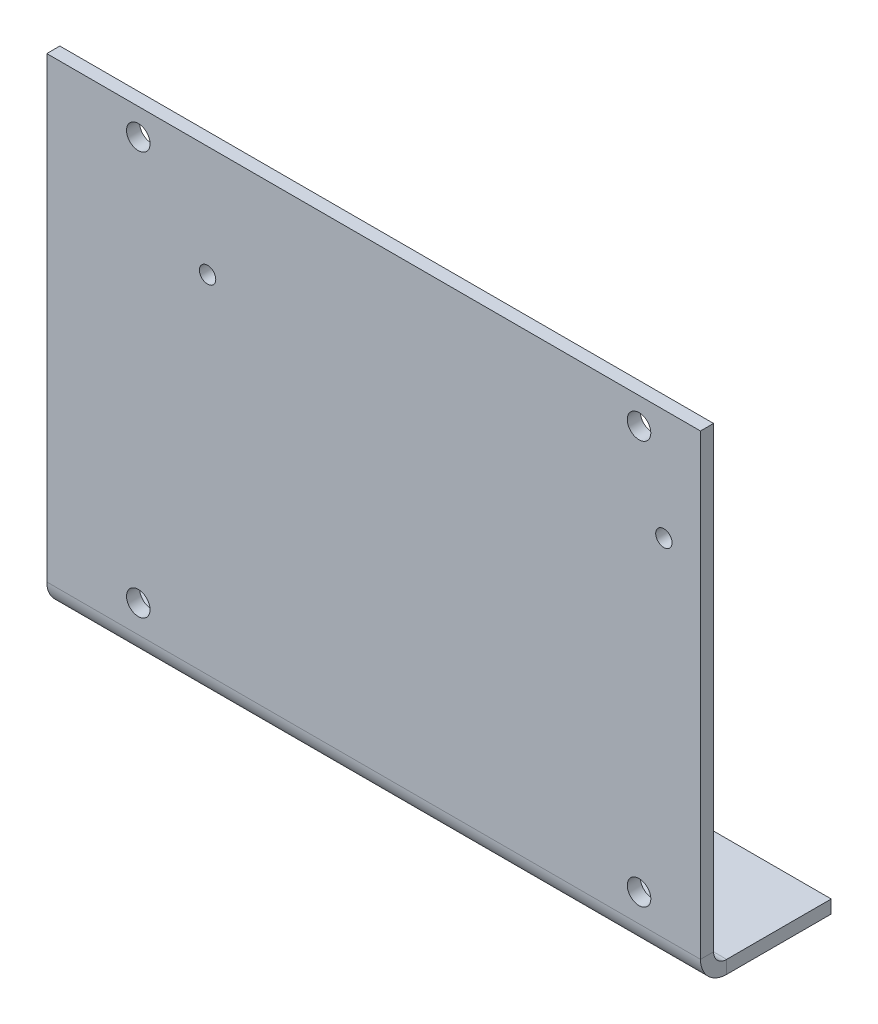
from build123d import *

# Parameters (mm, degrees)
SKETCH1_W                    = 100
SKETCH1_H                    = 20
BASE_FLANGE1_DEPTH           = 2
EDGE_FLANGE1_STRIP_W         = 12
EDGE_FLANGE1_STRIP_H         = 2
EDGE_FLANGE1_STRIP_CUT_DEPTH = 100
EDGE_FLANGE1_DEPTH           = 100
M3_5_CLEARANCE_HOLE1_D       = 2.5
M3_CLEARANCE_HOLE1_D         = 3.6


# Sheet-metal steps are written as plain solids
with BuildPart() as part:
    # Sketch1 → Base-Flange1 (new body)
    with BuildSketch(Plane(origin=(0, 0, 0), x_dir=(1, 0, 0), z_dir=(0, 1, 0))):
        Rectangle(SKETCH1_W, SKETCH1_H)
    extrude(amount=-BASE_FLANGE1_DEPTH)

    # Edge-Flange1 strip (across the edge) → Edge-Flange1 strip cut (cut)
    with BuildSketch(Plane(origin=(-50, 0, 10), x_dir=(0, 0, -1), z_dir=(1, 0, 0))):
        with Locations((-2, -1)):
            Rectangle(EDGE_FLANGE1_STRIP_W, EDGE_FLANGE1_STRIP_H)
    extrude(amount=EDGE_FLANGE1_STRIP_CUT_DEPTH, mode=Mode.SUBTRACT)

    # Edge-Flange1 section (across the edge) → Edge-Flange1 (add)
    with BuildSketch(Plane(origin=(-50, 0, 10), x_dir=(0, 0, -1), z_dir=(1, 0, 0))):
        with BuildLine():
            Line((0, 2), (0, 72))
            Line((0, 72), (2, 72))
            Line((2, 72), (2, 2))
            ThreePointArc((2, 2), (2.585786438, 0.585786438), (4, 0))
            Line((4, 0), (4, -2))
            ThreePointArc((4, -2), (1.171572875, -0.828427125), (0, 2))
        make_face()
    extrude(amount=EDGE_FLANGE1_DEPTH)

    # M3.5 Clearance Hole1 (through all)
    with Locations(Plane(origin=(114.471522339, -206.957964235, 10), x_dir=(1, 0, 0), z_dir=(0, 0, 1))):
        with Locations((-139.871522339, 261.957964236), (-70.071522339, 261.957964236)):
            Hole(M3_5_CLEARANCE_HOLE1_D / 2)

    # M3 Clearance Hole1 (through all)
    with Locations(Plane(origin=(114.471522339, -206.957964235, 8), x_dir=(1, 0, 0), z_dir=(0, 0, -1))):
        with Locations((-150.471522339, -274.892964235), (-73.871522339, -274.892964235), (-73.871522339, -213.172964235), (-150.471522339, -213.172964235)):
            Hole(M3_CLEARANCE_HOLE1_D / 2)


solid = part.part
